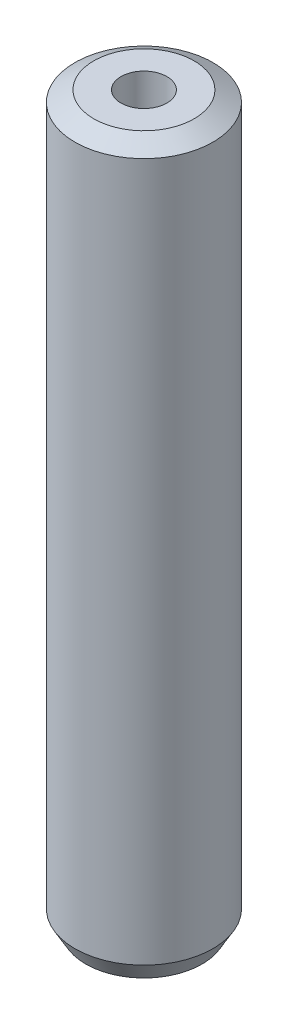
from build123d import *
from OCP.BRepFilletAPI import BRepFilletAPI_MakeChamfer

# Parameters (mm, degrees)
SKETCH1_R           = 35
BOSS_EXTRUDE1_DEPTH = 369.297957701
SKETCH2_R           = 11.651275917
CUT_EXTRUDE1_DEPTH  = 373.600297319
CHAMFER1_SIZE       = 5.503580879
CHAMFER1_SIZE2      = 9.532481705


with BuildPart() as part:
    # Sketch1 → Boss-Extrude1 (new body)
    with BuildSketch(Plane(origin=(0, 0, 0), x_dir=(1, 0, 0), z_dir=(0, 1, 0))):
        Circle(SKETCH1_R)
    extrude(amount=BOSS_EXTRUDE1_DEPTH)

    # Sketch2 → Cut-Extrude1 (cut, through all)
    with BuildSketch(Plane(origin=(0, 0, 0), x_dir=(1, 0, 0), z_dir=(0, 1, 0))):
        Circle(SKETCH2_R)
    extrude(amount=CUT_EXTRUDE1_DEPTH, mode=Mode.SUBTRACT)

    # Chamfer1: one chamfer whose edges measure the first distance from different faces: ONE call of the kernel's chamfer builder (chamfer() names one face for all edges)
    chamfer1_edges_1 = [part.edges().sort_by_distance(p)[0] for p in [
        (-35, 369.297957701, 0),
    ]]
    chamfer1_side_1 = [part.faces().sort_by_distance(p)[0] for p in [
        (-35, 184.648978851, 0),
    ]]
    chamfer1_edges_2 = [part.edges().sort_by_distance(p)[0] for p in [
        (-35, 0, 0),
    ]]
    chamfer1_side_2 = [part.faces().sort_by_distance(p)[0] for p in [
        (-34.010050506, 0, 0),
    ]]
    chamfer1 = BRepFilletAPI_MakeChamfer(part.part.solid().wrapped)
    for e in chamfer1_edges_1:
        chamfer1.Add(CHAMFER1_SIZE, CHAMFER1_SIZE2, e.wrapped, chamfer1_side_1[0].wrapped)  # the first distance lies on this face
    for e in chamfer1_edges_2:
        chamfer1.Add(CHAMFER1_SIZE, CHAMFER1_SIZE2, e.wrapped, chamfer1_side_2[0].wrapped)  # the first distance lies on this face
    add(Compound.cast(chamfer1.Shape()), mode=Mode.REPLACE)


solid = part.part
